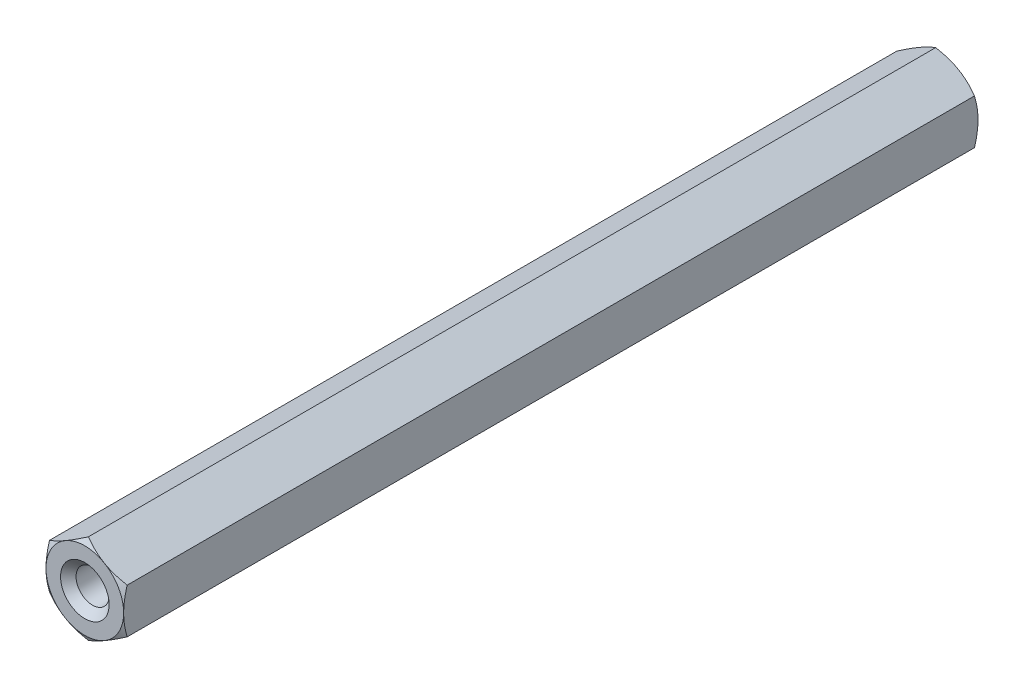
from build123d import *

# Parameters (mm, degrees)
EXTRUDE1_DEPTH                  = 34.925
EXTRUDE1_DEPTH_BACK             = 34.925
SKETCH1_R                       = 1.7526
SWEEP1_PITCH                    = 0.79375
EXTRUDE2_DEPTH                  = 71.810206606
SKETCH8_OUTSIDE_W               = 271.37
SKETCH8_OUTSIDE_H               = 272.352
SKETCH8_OUTSIDE_R               = 3.175
EXTRUDE4_DEPTH                  = 71.810206606
EXTRUDE4_DRAFT                  = -60
MIRROR1_COPY_1_SKETCH_W         = 271.37
MIRROR1_COPY_1_SKETCH_H         = 272.352
MIRROR1_COPY_1_SKETCH_R         = 3.175
MIRROR1_COPY_1_DEPTH            = 71.810206606
MIRROR1_COPY_1_DRAFT            = -60
SKETCH9_W                       = 50.8
SKETCH9_H                       = 1.8034
SKETCH14_R                      = 2.341640739
BOSS_EXTRUDE1_DEPTH             = 69.85
F_6_32_TAPPED_HOLE1_D           = 2.7051
F_6_32_TAPPED_HOLE1_DEPTH       = 10.9728
F_6_32_TAPPED_HOLE1_CSINK_D     = 3.9751
F_6_32_TAPPED_HOLE1_CSINK_ANGLE = 90
F_6_32_TAPPED_HOLE1_TIP         = 0.81269403
F_6_32_TAPPED_HOLE2_D           = 2.7051
F_6_32_TAPPED_HOLE2_DEPTH       = 10.9728
F_6_32_TAPPED_HOLE2_CSINK_D     = 3.9751
F_6_32_TAPPED_HOLE2_CSINK_ANGLE = 90
F_6_32_TAPPED_HOLE2_TIP         = 0.81269403


with BuildPart() as part:
    # Sketch1 → Extrude1 (new, two sides: drawn at the far end of the back side and taken through both)
    with BuildSketch(Plane.XY.offset(-EXTRUDE1_DEPTH_BACK)):
        Polygon((0, 3.666174209), (-3.175, 1.833087105), (-3.175, -1.833087105), (0, -3.666174209), (3.175, -1.833087105), (3.175, 1.833087105), align=None)
        Circle(SKETCH1_R, mode=Mode.SUBTRACT)
    extrude(amount=EXTRUDE1_DEPTH + EXTRUDE1_DEPTH_BACK)

    # Sweep1: arcs per turn and ends read off the stored shape
    # Sweep1: the profile of Sketch12 profile screwed along a right-hand helix through 89 turns, 6 arcs to a turn; built about Z, then put on its axis
    sweep1_z = Axis((0, 0, 0), (0, 0, 1))
    sweep1_corners = [(1.7529, 0, -0.694704455), (1.7529, 0, 0.000173205), (1.237044252, 0, -0.29765625), (1.237044252, 0, -0.396875)]
    with BuildLine(mode=Mode.PRIVATE) as sweep1_profile:
        Line(sweep1_corners[0], sweep1_corners[1])
        Line(sweep1_corners[1], sweep1_corners[2])
        Line(sweep1_corners[2], sweep1_corners[3])
        Line(sweep1_corners[3], sweep1_corners[0])
    sweep1_cap = Face(sweep1_profile.wire())
    sweep1_turn_angles = [0, 30, 60, 90, 120, 150, 180, 210, 240, 270, 300, 330, 360]
    sweep1_turn_weights = [1, 0.8660254037844387, 1, 0.8660254037844387, 1, 0.8660254037844387, 1, 0.8660254037844387, 1, 0.8660254037844387, 1, 0.8660254037844387, 1]
    sweep1_turn_rails = [Edge.make_bspline([Vector(p[0], p[1], 0).rotate(sweep1_z, sweep1_turn_angles[k]) / sweep1_turn_weights[k] + Vector(0, 0, p[2] + SWEEP1_PITCH * sweep1_turn_angles[k] / 360) for k in range(13)], [0, 0, 0, 1, 1, 2, 2, 3, 3, 4, 4, 5, 5, 6, 6, 6], 2, sweep1_turn_weights) for p in sweep1_corners]
    sweep1_turn_sides = [Face.make_surface_from_curves(sweep1_turn_rails[p[0]], sweep1_turn_rails[p[1]]) for p in [(0, 1), (1, 2), (2, 3), (3, 0)]]
    sweep1_turn = Solid(Shell([*sweep1_turn_sides, sweep1_cap, sweep1_cap.rotate(sweep1_z, 360).moved(Location((0, 0, SWEEP1_PITCH * 360 / 360)))]))
    sweep1_each = [*[sweep1_turn.moved(Location((0, 0, SWEEP1_PITCH * i))) for i in range(89)]]
    add(Plane(origin=(0, 0, -34.925), x_dir=(0, 1, 0), z_dir=(0, 0, 1)) * Compound([sweep1_each[i] for i in range(0, 89, 2)]))
    add(Plane(origin=(0, 0, -34.925), x_dir=(0, 1, 0), z_dir=(0, 0, 1)) * Compound([sweep1_each[i] for i in range(1, 89, 2)]))

    # Sketch6 → Extrude2 (cut, through all)
    with BuildSketch(Plane(origin=(0, 0, -34.925), x_dir=(-1, 0, 0), z_dir=(0, 0, -1))):
        Polygon((0, 3.666174209), (-3.175, 1.833087105), (-3.175, -1.833087105), (0, -3.666174209), (3.175, -1.833087105), (3.175, 1.833087105), align=None)
    extrude2 = extrude(amount=EXTRUDE2_DEPTH, mode=Mode.SUBTRACT)

    # Extrude3 cone 1 section (through the dimple's axis) → Extrude3 (revolve, cut)
    with BuildSketch(Plane(origin=(0, 0, -34.925), x_dir=(0, 1, 0), z_dir=(1, 0, 0))):
        Polygon((0, 0), (1.8034, 0), (0, 1.933909732), align=None)
    extrude3 = revolve(axis=Axis((0, 0, -34.925), (0, 0, 1)), mode=Mode.SUBTRACT)


with BuildPart() as extrude4_tool:
    # Sketch8 outside → Extrude4 (with draft: the straight prism first)
    with BuildSketch(Plane(origin=(0, 0, -34.925), x_dir=(-1, 0, 0), z_dir=(0, 0, -1))):
        Rectangle(SKETCH8_OUTSIDE_W, SKETCH8_OUTSIDE_H)
        Circle(SKETCH8_OUTSIDE_R, mode=Mode.SUBTRACT)
    extrude(amount=-EXTRUDE4_DEPTH)
    # Extrude4: the draft: its side faces are tilted about the plane it starts from
    extrude4_sides = [extrude4_tool.faces().sort_by_distance(p)[0] for p in [
        (0, -136.176, 0.980103303),
        (-135.685, 0, 0.980103303),
        (0, 136.176, 0.980103303),
        (135.685, 0, 0.980103303),
        (3.175, 0, 0.980103303),
    ]]
    draft(extrude4_sides, Plane(origin=(0, 0, -34.925), x_dir=(-1, 0, 0), z_dir=(0, 0, -1)), EXTRUDE4_DRAFT)


with BuildPart() as part_1:
    add(part.part)

    # Extrude4: cut by extrude4_tool
    add(extrude4_tool.part, mode=Mode.SUBTRACT)

    # Mirror1: Extrude2, Extrude3 across plane
    add(extrude2.mirror(Plane.XY), mode=Mode.SUBTRACT)
    add(extrude3.mirror(Plane.XY), mode=Mode.SUBTRACT)


with BuildPart() as mirror1_copy_1_tool:
    # Mirror1 copy 1 sketch → Mirror1 copy 1 (with draft: the straight prism first)
    with BuildSketch(Plane(origin=(0, 0, 34.925), x_dir=(-1, 0, 0), z_dir=(0, 0, 1))):
        Rectangle(MIRROR1_COPY_1_SKETCH_W, MIRROR1_COPY_1_SKETCH_H)
        Circle(MIRROR1_COPY_1_SKETCH_R, mode=Mode.SUBTRACT)
    extrude(amount=-MIRROR1_COPY_1_DEPTH)
    # Mirror1 copy 1: the draft: its side faces are tilted about the plane it starts from
    mirror1_copy_1_sides = [mirror1_copy_1_tool.faces().sort_by_distance(p)[0] for p in [
        (0, -136.176, -0.980103303),
        (-135.685, 0, -0.980103303),
        (0, 136.176, -0.980103303),
        (135.685, 0, -0.980103303),
        (3.175, 0, -0.980103303),
    ]]
    draft(mirror1_copy_1_sides, Plane(origin=(0, 0, 34.925), x_dir=(-1, 0, 0), z_dir=(0, 0, 1)), MIRROR1_COPY_1_DRAFT)


with BuildPart() as part_2:
    add(part_1.part)

    # Mirror1 copy 1: cut by mirror1_copy_1_tool
    add(mirror1_copy_1_tool.part, mode=Mode.SUBTRACT)

    # Sketch9 → Revolve 2 (revolve)
    with BuildSketch(Plane(origin=(0, 0, 0), x_dir=(0, 0, -1), z_dir=(1, 0, 0)), mode=Mode.PRIVATE) as revolve_2_sk:
        with Locations((0, 0.9017)):
            Rectangle(SKETCH9_W, SKETCH9_H)
    revolve(revolve_2_sk.sketch.rotate(Axis((0, 0, 34.925), (0, 0, -1)), 270), axis=Axis((0, 0, 34.925), (0, 0, -1)))

    # Sketch14 → Boss-Extrude1 (add)
    with BuildSketch(Plane.XY.offset(34.925)):
        Circle(SKETCH14_R)
    extrude(amount=-BOSS_EXTRUDE1_DEPTH)

    # #6-32 Tapped Hole1
    with Locations(Plane(origin=(0, 0, -34.925), x_dir=(-1, 0, 0), z_dir=(0, 0, -1))):
        with Locations((0, 0)):
            CounterSinkHole(F_6_32_TAPPED_HOLE1_D / 2, F_6_32_TAPPED_HOLE1_CSINK_D / 2, depth=F_6_32_TAPPED_HOLE1_DEPTH, counter_sink_angle=F_6_32_TAPPED_HOLE1_CSINK_ANGLE)
            with Locations((0, 0, -(F_6_32_TAPPED_HOLE1_DEPTH + F_6_32_TAPPED_HOLE1_TIP / 2))):  # 118° drill point
                Cone(0, F_6_32_TAPPED_HOLE1_D / 2, F_6_32_TAPPED_HOLE1_TIP, mode=Mode.SUBTRACT)

    # #6-32 Tapped Hole2
    with Locations(Plane.XY.offset(34.925)):
        with Locations((0, 0)):
            CounterSinkHole(F_6_32_TAPPED_HOLE2_D / 2, F_6_32_TAPPED_HOLE2_CSINK_D / 2, depth=F_6_32_TAPPED_HOLE2_DEPTH, counter_sink_angle=F_6_32_TAPPED_HOLE2_CSINK_ANGLE)
            with Locations((0, 0, -(F_6_32_TAPPED_HOLE2_DEPTH + F_6_32_TAPPED_HOLE2_TIP / 2))):  # 118° drill point
                Cone(0, F_6_32_TAPPED_HOLE2_D / 2, F_6_32_TAPPED_HOLE2_TIP, mode=Mode.SUBTRACT)


solid = part_2.part
